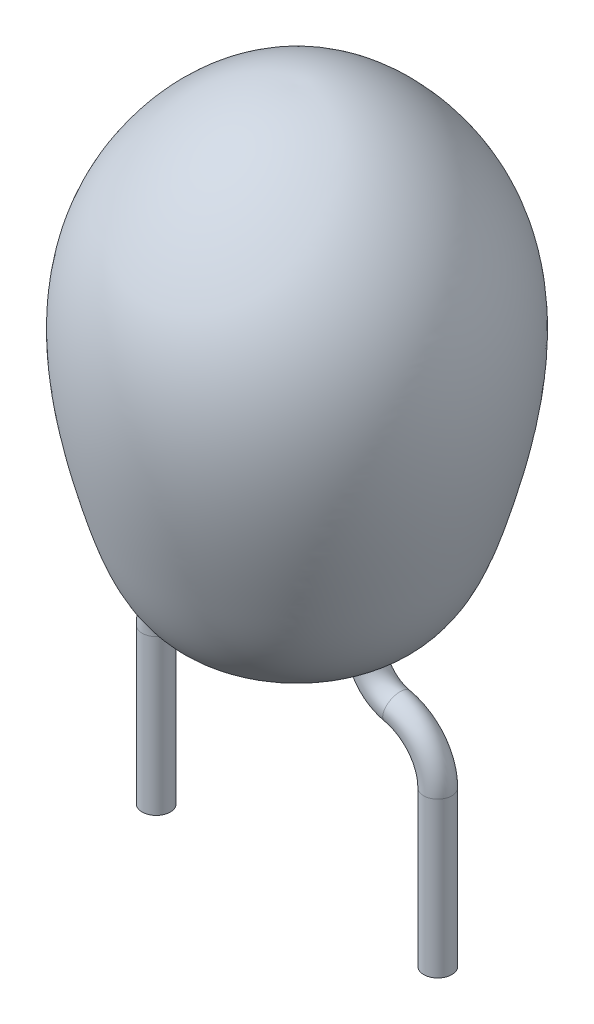
from build123d import *

# Parameters (mm, degrees)
SKETCH2_R = 0.254


# Read off the part's stored shape, not the designer's step: Boss-Revolve1
with BuildPart() as part:
    # Base-Sweep: sweep along a path in Sketch1
    with BuildLine(Plane.XY) as base_sweep_path:
        Line((0, -2.54), (0, 0.254))
        ThreePointArc((0, 0.254), (0.206067938, 0.840178395), (0.733609559, 1.1684602))
        ThreePointArc((0.733609559, 1.1684602), (1.13814331, 1.420195921), (1.296162, 1.869694))
    # Sketch2 → Base-Sweep (sweep)
    with BuildSketch(Plane(origin=(0, -2.54, 0), x_dir=(-1, 0, 0), z_dir=(0, 1, 0))):
        Circle(SKETCH2_R)
    base_sweep = sweep(path=base_sweep_path.line)

    # Boss-Revolve1 outline → Boss-Revolve1 (revolve)
    with BuildSketch(Plane(origin=(2.54, 0, 0), x_dir=(1, 0, 0), z_dir=(0, 0, 1))):
        with BuildLine():
            add(Edge.make_bspline(
                [(0, 9.97458), (0.034789438, 9.975104259), (0.069578876, 9.975628519), (0.104334188, 9.975628519)],
                knots=[0, 0, 0, 0, 0.008939428, 0.008939428, 0.008939428, 0.008939428], degree=3))
            Line((0, 9.97458), (0, 1.869694))
            Line((0, 1.869694), (0.989838, 1.869694))
            Line((0.989838, 1.869694), (0.989838, 9.79047937))
            add(Edge.make_bspline(
                [(0.104334188, 9.975628519), (0.129776876, 9.97562852), (0.431674151, 9.972292434), (0.729105194, 9.900343228), (0.989838, 9.79047937)],
                knots=[0.008939428, 0.008939428, 0.008939428, 0.008939428, 0.015483553, 0.086646407, 0.086646407, 0.086646407, 0.086646407], degree=3))
        make_face()
        with BuildLine():
            Line((0.989838, 1.869694), (0, 1.869694))
            Line((0, 1.869694), (0, 1.51638))
            add(Edge.make_bspline(
                [(0.196700703, 1.513588098), (0.131247283, 1.513588098), (0.065623641, 1.514984049), (0, 1.51638)],
                knots=[0.983164699, 0.983164699, 0.983164699, 0.983164699, 1, 1, 1, 1], degree=3))
            add(Edge.make_bspline(
                [(0.989838, 1.605037356), (0.981620664, 1.603413128), (0.763396717, 1.560584076), (0.502269322, 1.517618443), (0.244615949, 1.513588098), (0.196700703, 1.513588098)],
                knots=[0.914652434, 0.914652434, 0.914652434, 0.914652434, 0.91676716, 0.970840398, 0.983164699, 0.983164699, 0.983164699, 0.983164699], degree=3))
            Line((0.989838, 1.605037356), (0.989838, 1.869694))
        make_face()
        with BuildLine():
            add(Edge.make_bspline(
                [(0.989838, 9.79047937), (1.16524628, 9.716568339), (1.335381856, 9.62275499), (1.497838, 9.513170946)],
                knots=[0.086646407, 0.086646407, 0.086646407, 0.086646407, 0.134521294, 0.134521294, 0.134521294, 0.134521294], degree=3))
            Line((0.989838, 9.79047937), (0.989838, 1.869694))
            Line((0.989838, 1.869694), (1.497838, 1.869694))
            Line((1.497838, 1.869694), (1.497838, 9.513170946))
        make_face()
        with BuildLine():
            Line((1.497838, 1.869694), (0.989838, 1.869694))
            Line((0.989838, 1.869694), (0.989838, 1.605037356))
            add(Edge.make_bspline(
                [(1.497838, 1.737836694), (1.336832685, 1.678684631), (1.162426271, 1.639150937), (0.989838, 1.605037356)],
                knots=[0.870236962, 0.870236962, 0.870236962, 0.870236962, 0.914652434, 0.914652434, 0.914652434, 0.914652434], degree=3))
            Line((1.497838, 1.737836694), (1.497838, 1.869694))
        make_face()
        with BuildLine():
            add(Edge.make_bspline(
                [(1.497838, 9.513170946), (1.987948233, 9.182569344), (2.943587185, 8.104298759), (3.195965667, 6.870404718), (3.195965666, 6.150823028)],
                knots=[0.134521294, 0.134521294, 0.134521294, 0.134521294, 0.278953951, 0.462984826, 0.462984826, 0.462984826, 0.462984826], degree=3))
            Line((1.497838, 9.513170946), (1.497838, 1.869694))
            Line((1.497838, 1.869694), (1.771903838, 1.869694))
            add(Edge.make_bspline(
                [(3.195965666, 6.150823028), (3.195965665, 5.337471481), (2.865595277, 3.784051735), (2.314325025, 2.209352107), (1.771903838, 1.869694)],
                knots=[0.462984826, 0.462984826, 0.462984826, 0.462984826, 0.670997063, 0.843382412, 0.843382412, 0.843382412, 0.843382412], degree=3))
        make_face()
        with BuildLine():
            Line((1.771903838, 1.869694), (1.497838, 1.869694))
            Line((1.497838, 1.869694), (1.497838, 1.737836694))
            add(Edge.make_bspline(
                [(1.771903838, 1.869694), (1.749060972, 1.855390051), (1.662641881, 1.804930677), (1.568869253, 1.763933007), (1.497838, 1.737836694)],
                knots=[0.843382412, 0.843382412, 0.843382412, 0.843382412, 0.85064204, 0.870236962, 0.870236962, 0.870236962, 0.870236962], degree=3))
        make_face()
    revolve(axis=Axis((2.54, 0, 0), (0, 1, 0)))

    # Mirror1: Base-Sweep across plane
    add(base_sweep.mirror(Plane(origin=(2.54, 0, 0), x_dir=(0, 0, 1), z_dir=(1, 0, 0))))


solid = part.part
